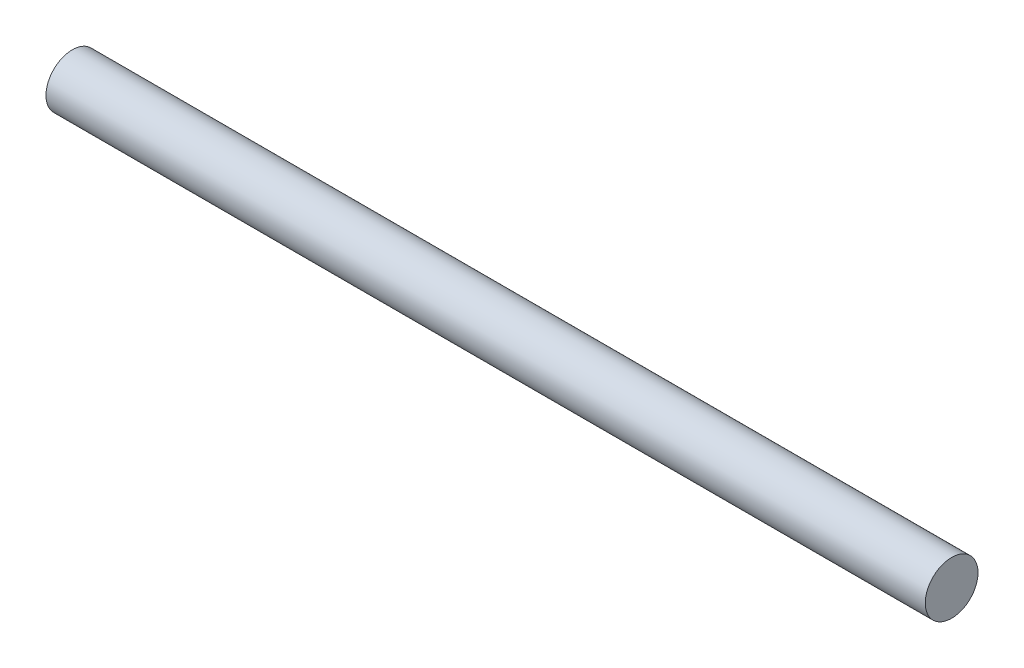
from build123d import *

# Parameters (mm, degrees)
EXTRUDE1_DEPTH      = 25
EXTRUDE1_DEPTH_BACK = 25
SKETCH1_R           = 1.5


with BuildPart() as part:
    # Sketch1 → Extrude1 (new, two sides: drawn at the far end of the back side and taken through both)
    with BuildSketch(Plane(origin=(0, 0, 0), x_dir=(0, 0, -1), z_dir=(1, 0, 0)).offset(-EXTRUDE1_DEPTH_BACK)):
        Circle(SKETCH1_R)
    extrude(amount=EXTRUDE1_DEPTH + EXTRUDE1_DEPTH_BACK)


solid = part.part
